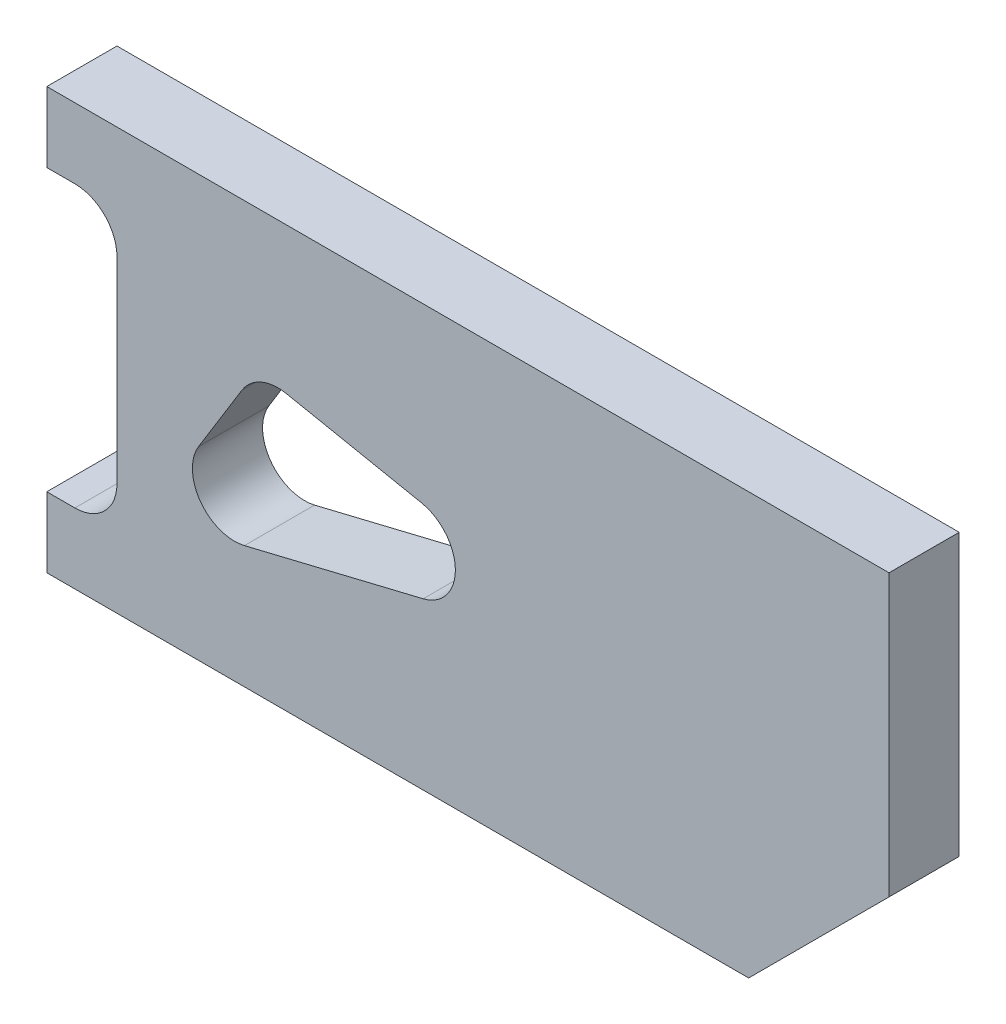
from build123d import *

# Parameters (mm, degrees)
EXTRUDE_1_DEPTH = 5


with BuildPart() as part:
    # ｽｹｯﾁ1 → ﾎﾞｽ - 押し出し1 (new body)
    with BuildSketch(Plane.XY):
        with BuildLine():
            Line((0, 5), (0, 0))
            Line((0, 0), (50, 0))
            Line((50, 0), (60, 10))
            Line((60, 10), (60, 30))
            Line((60, 30), (0, 30))
            Line((0, 30), (0, 25))
            Line((0, 25), (2, 25))
            ThreePointArc((2, 25), (4.121320344, 24.121320344), (5, 22))
            Line((5, 22), (5, 8))
            ThreePointArc((5, 8), (4.121320344, 5.878679656), (2, 5))
            Line((2, 5), (0, 5))
        make_face()
        with BuildLine():
            ThreePointArc((14.079703922, 8.71629186), (10.946152853, 9.868073592), (10.817928895, 13.204134454))
            Line((10.817928895, 13.204134454), (13.905142783, 18.220857022))
            ThreePointArc((13.905142783, 18.220857022), (15.261888562, 19.398882337), (17.048466138, 19.590306772))
            Line((17.048466138, 19.590306772), (26.696009539, 17.660798092))
            ThreePointArc((26.696009539, 17.660798092), (29.107047871, 14.779712483), (26.814461211, 11.803505748))
            Line((26.814461211, 11.803505748), (14.079703922, 8.71629186))
        make_face(mode=Mode.SUBTRACT)
    extrude(amount=EXTRUDE_1_DEPTH)


solid = part.part
